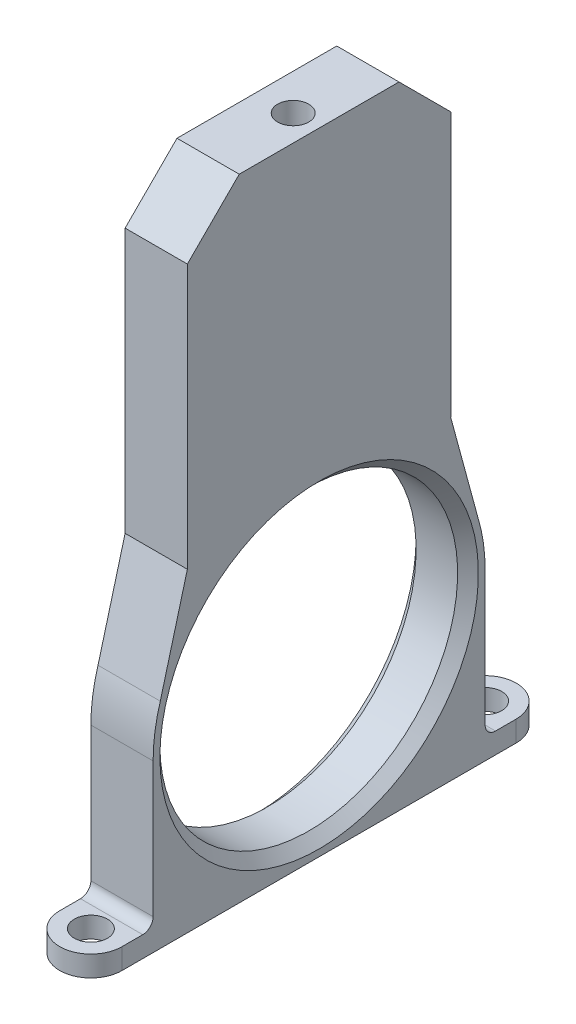
from build123d import *

# Parameters (mm, degrees)
SKETCH1_W                       = 6
SKETCH1_H                       = 25.4
SKETCH1_R                       = 1.5
BOSS_EXTRUDE1_DEPTH             = 30.48
SKETCH3_R                       = 1.5
BOSS_EXTRUDE4_DEPTH             = 2
BOSS_EXTRUDE6_REACH             = 35.205
SKETCH2_R                       = 14.35
BOSS_EXTRUDE6_DIRECTION_2_REACH = 35.205
SKETCH4_R                       = 1.6
BOSS_EXTRUDE7_DEPTH             = 2
FILLET1_R                       = 1
CHAMFER1_SIZE                   = 5
CHAMFER2_SIZE                   = 1


with BuildPart() as part:
    # Sketch1 → Boss-Extrude1 (new body)
    with BuildSketch(Plane(origin=(0, 0, 0), x_dir=(1, 0, 0), z_dir=(0, 1, 0))):
        with Locations((-0.5, 0)):
            Rectangle(SKETCH1_W, SKETCH1_H)
        Circle(SKETCH1_R, mode=Mode.SUBTRACT)
    extrude(amount=BOSS_EXTRUDE1_DEPTH)

    # Sketch3 → Boss-Extrude4 (add)
    with BuildSketch(Plane.XZ):
        Circle(SKETCH3_R)
    extrude(amount=-BOSS_EXTRUDE4_DEPTH)

    # Boss-Extrude6: up to this face of the body (flat: up to its plane)
    boss_extrude6_end = Plane(part.part.faces().sort_by_distance((2.5, 15.24, 0))[0])
    # Sketch2 → Boss-Extrude6 (add, up to the picked face)
    with BuildSketch(Plane(origin=(0, 0, 0), x_dir=(0, 0, -1), z_dir=(1, 0, 0)), mode=Mode.PRIVATE) as boss_extrude6_sk1:
        with BuildLine():
            Line((-12.7, 0), (-15.311216548, -9.706009494))
            ThreePointArc((-15.311216548, -9.706009494), (-15.826867422, -12.002604078), (-16, -14.35))
            Line((-16, -14.35), (-16, -30.35))
            Line((-16, -30.35), (0, -30.35))
            Line((0, -30.35), (16, -30.35))
            Line((16, -30.35), (16, -14.35))
            ThreePointArc((16, -14.35), (15.826867422, -12.002604078), (15.311216548, -9.706009494))
            Line((15.311216548, -9.706009494), (12.680222825, 0))
            Line((12.680222825, 0), (12.7, 2.89087835))
            Line((12.7, 2.89087835), (-12.7, 2.89087835))
            Line((-12.7, 2.89087835), (-12.7, 0))
        make_face()
        with Locations((0, -14.35)):
            Circle(SKETCH2_R, mode=Mode.SUBTRACT)
    boss_extrude6_tool1 = split(extrude(boss_extrude6_sk1.sketch, amount=BOSS_EXTRUDE6_REACH, mode=Mode.PRIVATE), bisect_by=boss_extrude6_end, keep=Keep.BOTH, mode=Mode.PRIVATE)
    add(boss_extrude6_tool1.solids().sort_by(Axis((0, -4.972875, 13.560045), (1, 0, 0)))[0])

    # Boss-Extrude6 direction 2: up to this face of the body (flat: up to its plane)
    boss_extrude6_direction_2_end = Plane(part.part.faces().sort_by_distance((-3.5, 15.24, 0))[0])
    # Sketch2 → Boss-Extrude6 direction 2 (add, up to the picked face)
    with BuildSketch(Plane(origin=(0, 0, 0), x_dir=(0, 0, -1), z_dir=(1, 0, 0)), mode=Mode.PRIVATE) as boss_extrude6_direction_2_sk1:
        with BuildLine():
            Line((-12.7, 0), (-15.311216548, -9.706009494))
            ThreePointArc((-15.311216548, -9.706009494), (-15.826867422, -12.002604078), (-16, -14.35))
            Line((-16, -14.35), (-16, -30.35))
            Line((-16, -30.35), (0, -30.35))
            Line((0, -30.35), (16, -30.35))
            Line((16, -30.35), (16, -14.35))
            ThreePointArc((16, -14.35), (15.826867422, -12.002604078), (15.311216548, -9.706009494))
            Line((15.311216548, -9.706009494), (12.680222825, 0))
            Line((12.680222825, 0), (12.7, 2.89087835))
            Line((12.7, 2.89087835), (-12.7, 2.89087835))
            Line((-12.7, 2.89087835), (-12.7, 0))
        make_face()
        with Locations((0, -14.35)):
            Circle(SKETCH2_R, mode=Mode.SUBTRACT)
    boss_extrude6_direction_2_tool1 = split(extrude(boss_extrude6_direction_2_sk1.sketch, amount=-BOSS_EXTRUDE6_DIRECTION_2_REACH, mode=Mode.PRIVATE), bisect_by=boss_extrude6_direction_2_end, keep=Keep.BOTH, mode=Mode.PRIVATE)
    add(boss_extrude6_direction_2_tool1.solids().sort_by(Axis((0, -4.972875, 13.560045), (-1, 0, 0)))[0])

    # Sketch4 → Boss-Extrude7 (add)
    # profile 1 of 2: a face of its own
    with BuildSketch(Plane.XZ.offset(30.35)):
        with BuildLine():
            Line((-3.5, 19), (-3.5, 16))
            Line((-3.5, 16), (2.5, 16))
            Line((2.5, 16), (2.5, 19))
            ThreePointArc((2.5, 19), (-0.5, 22), (-3.5, 19))
        make_face()
        with Locations((-0.5, 19)):
            Circle(SKETCH4_R, mode=Mode.SUBTRACT)
    # profile 2 of 2: a face of its own
    with BuildSketch(Plane.XZ.offset(30.35)):
        with BuildLine():
            Line((2.5, -19), (2.5, -16))
            Line((2.5, -16), (-3.5, -16))
            Line((-3.5, -16), (-3.5, -19))
            ThreePointArc((-3.5, -19), (-0.5, -22), (2.5, -19))
        make_face()
        with Locations((-0.5, -19)):
            Circle(SKETCH4_R, mode=Mode.SUBTRACT)
    extrude(amount=-BOSS_EXTRUDE7_DEPTH)

    # Fillet1
    fillet1_edges = [part.edges().sort_by_distance(p)[0] for p in [
        (-0.5, -28.35, -16),
        (-0.5, -28.35, 16),
    ]]
    fillet(fillet1_edges, radius=FILLET1_R)

    # Chamfer1
    chamfer1_edges = [part.edges().sort_by_distance(p)[0] for p in [
        (-0.5, 30.48, -12.7),
        (-0.5, 30.48, 12.7),
    ]]
    chamfer(chamfer1_edges, length=CHAMFER1_SIZE)

    # Chamfer2
    chamfer2_edges = [part.edges().sort_by_distance(p)[0] for p in [
        (-3.5, -14.35, 14.35),
        (2.5, -14.35, 14.35),
    ]]
    chamfer(chamfer2_edges, length=CHAMFER2_SIZE)


solid = part.part
